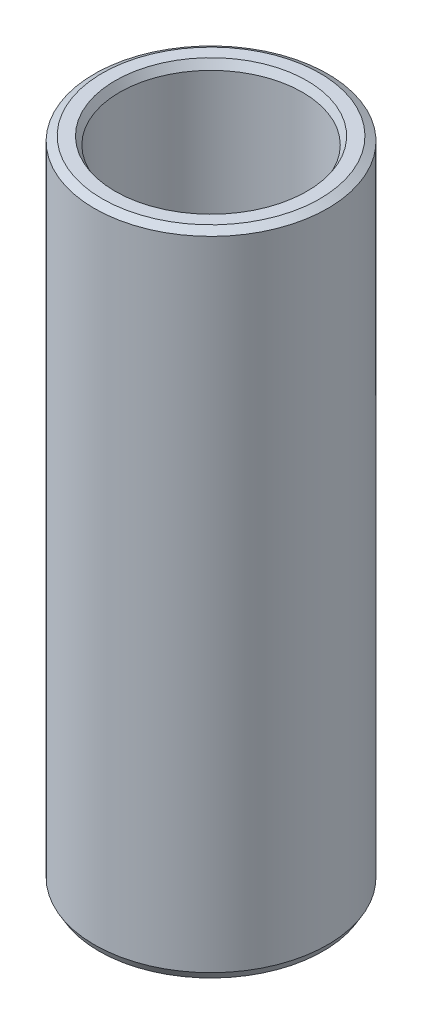
from build123d import *
from OCP.BRepFilletAPI import BRepFilletAPI_MakeChamfer

# Parameters (mm, degrees)
SKETCH1_R           = 52.5
BOSS_EXTRUDE1_DEPTH = 292.552172586
SKETCH2_R           = 41.138423782
CUT_EXTRUDE1_DEPTH  = 302.826562258
CHAMFER1_SIZE       = 2.024667181
CHAMFER1_SIZE2      = 3.506826425


with BuildPart() as part:
    # Sketch1 → Boss-Extrude1 (new body)
    with BuildSketch(Plane(origin=(0, 0, 0), x_dir=(1, 0, 0), z_dir=(0, 1, 0))):
        Circle(SKETCH1_R)
    extrude(amount=BOSS_EXTRUDE1_DEPTH)

    # Sketch2 → Cut-Extrude1 (cut, through all)
    with BuildSketch(Plane(origin=(0, 0, 0), x_dir=(1, 0, 0), z_dir=(0, 1, 0))):
        Circle(SKETCH2_R)
    extrude(amount=CUT_EXTRUDE1_DEPTH, mode=Mode.SUBTRACT)

    # Chamfer1: one chamfer whose edges measure the first distance from different faces: ONE call of the kernel's chamfer builder (chamfer() names one face for all edges)
    chamfer1_edges_1 = [part.edges().sort_by_distance(p)[0] for p in [
        (-41.138423782, 292.552172586, 0),
    ]]
    chamfer1_side_1 = [part.faces().sort_by_distance(p)[0] for p in [
        (-51.01507576, 292.552172586, 0),
    ]]
    chamfer1_edges_2 = [part.edges().sort_by_distance(p)[0] for p in [
        (-41.138423782, 0, 0),
    ]]
    chamfer1_side_2 = [part.faces().sort_by_distance(p)[0] for p in [
        (-41.138423782, 146.276086293, 0),
    ]]
    chamfer1_edges_3 = [part.edges().sort_by_distance(p)[0] for p in [
        (-52.5, 0, 0),
    ]]
    chamfer1_side_3 = [part.faces().sort_by_distance(p)[0] for p in [
        (-51.01507576, 0, 0),
    ]]
    chamfer1_edges_4 = [part.edges().sort_by_distance(p)[0] for p in [
        (-52.5, 292.552172586, 0),
    ]]
    chamfer1_side_4 = [part.faces().sort_by_distance(p)[0] for p in [
        (-52.5, 146.276086293, 0),
    ]]
    chamfer1 = BRepFilletAPI_MakeChamfer(part.part.solid().wrapped)
    for e in chamfer1_edges_1:
        chamfer1.Add(CHAMFER1_SIZE, CHAMFER1_SIZE2, e.wrapped, chamfer1_side_1[0].wrapped)  # the first distance lies on this face
    for e in chamfer1_edges_2:
        chamfer1.Add(CHAMFER1_SIZE, CHAMFER1_SIZE2, e.wrapped, chamfer1_side_2[0].wrapped)  # the first distance lies on this face
    for e in chamfer1_edges_3:
        chamfer1.Add(CHAMFER1_SIZE, CHAMFER1_SIZE2, e.wrapped, chamfer1_side_3[0].wrapped)  # the first distance lies on this face
    for e in chamfer1_edges_4:
        chamfer1.Add(CHAMFER1_SIZE, CHAMFER1_SIZE2, e.wrapped, chamfer1_side_4[0].wrapped)  # the first distance lies on this face
    add(Compound.cast(chamfer1.Shape()), mode=Mode.REPLACE)


solid = part.part
